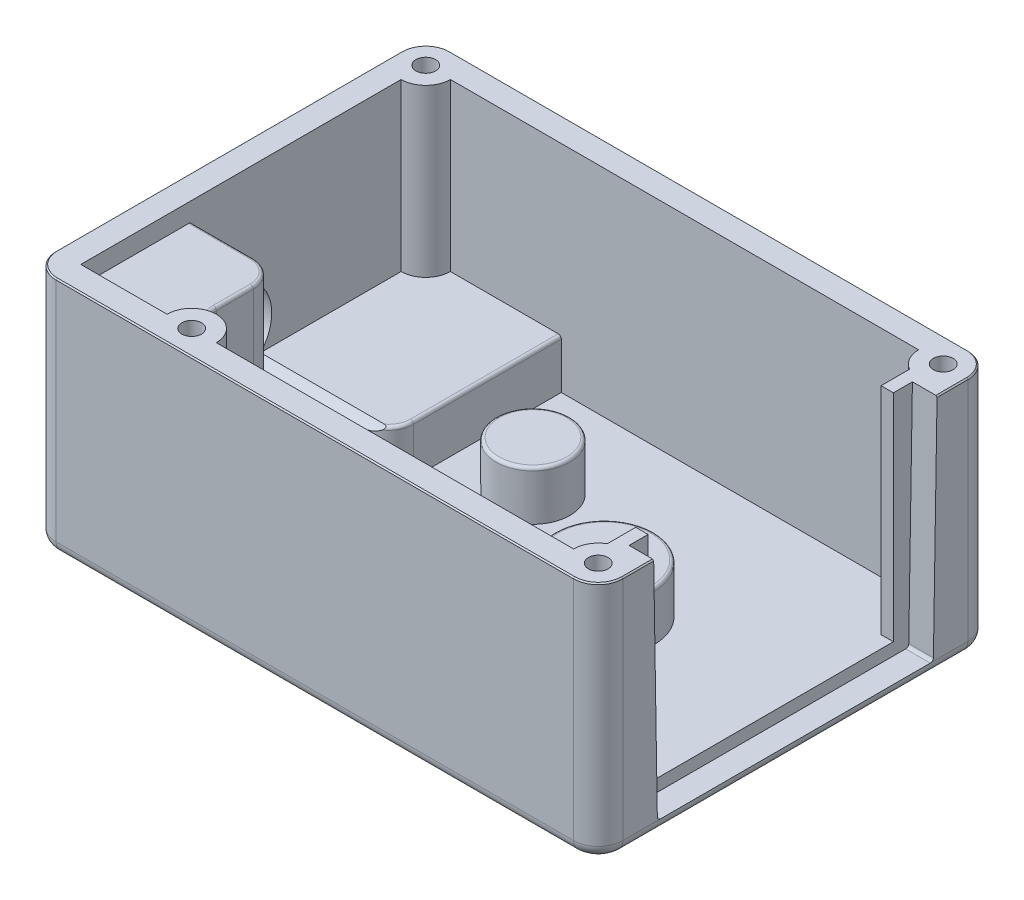
from build123d import *

# Parameters (mm, degrees)
BOSS_EXTRUDE1_DEPTH          = 19.5
FILLET1_R                    = 1
CUT_EXTRUDE1_START           = -17.5
CUT_EXTRUDE1_DEPTH           = 17.5
BOSS_EXTRUDE2_DEPTH          = 2
BOSS_EXTRUDE2_DEPTH_BACK     = 6
SKETCH6_R                    = 4
SKETCH6_R_2                  = 2.999999999999999
FILLET2_R                    = 0.25
M2X0_4_TAPPED_HOLE1_D        = 1.6
M2X0_4_TAPPED_HOLE1_DEPTH    = 8
M2X0_4_TAPPED_HOLE1_TIP      = 0.48068849522204826
CUT_EXTRUDE2_DEPTH           = 2
FILLET3_R                    = 0.25
BOSS_EXTRUDE3_START          = -17.5
BOSS_EXTRUDE3_DEPTH          = 17.5
M3X0_5_TAPPED_HOLE1_D        = 2.5
M3X0_5_TAPPED_HOLE1_DEPTH    = 7.5
M3X0_5_TAPPED_HOLE1_TIP      = 0.7510757737844503
F_7_0_7_DIAMETER_HOLE1_D     = 7
F_7_0_7_DIAMETER_HOLE1_DEPTH = 12.999
F_7_0_7_DIAMETER_HOLE1_TIP   = 2.103012166596461
BOSS_EXTRUDE4_DEPTH          = 16
BOSS_EXTRUDE5_DEPTH          = 4
FILLET4_R                    = 0.25
CHAMFER1_SIZE                = 0.1
SCALE1_SCALE                 = 1.5


with BuildPart() as part:
    # Sketch1 → Boss-Extrude1 (new body)
    with BuildSketch(Plane(origin=(0, 0, 0), x_dir=(1, 0, 0), z_dir=(0, 1, 0))):
        with BuildLine():
            Line((-28.499999999999993, 16), (13.500000000000002, 16))
            ThreePointArc((13.500000000000002, 16), (14.914213562373098, 15.414213562373096), (15.500000000000005, 14))
            Line((15.500000000000005, 14), (15.500000000000005, -14))
            ThreePointArc((15.500000000000005, -14), (14.914213562373098, -15.414213562373096), (13.500000000000002, -16))
            Line((13.500000000000002, -16), (-28.499999999999993, -16))
            ThreePointArc((-28.499999999999993, -16), (-29.914213562373092, -15.414213562373098), (-30.499999999999996, -14))
            Line((-30.499999999999996, -14), (-30.499999999999996, 14))
            ThreePointArc((-30.499999999999996, 14), (-29.91421356237309, 15.414213562373096), (-28.499999999999993, 16))
        make_face()
    extrude(amount=BOSS_EXTRUDE1_DEPTH)

    # Fillet1
    fillet1_edges = [part.edges().sort_by_distance(p)[0] for p in [
        (-30.499999999999996, 0, 0),
        (-29.91421356237309, 0, -15.414213562373096),
        (-7.4999999999999964, 0, -16),
        (14.914213562373098, 0, -15.414213562373096),
        (15.500000000000005, 0, 0),
        (14.914213562373098, 0, 15.414213562373096),
        (-7.499999999999995, 0, 16),
        (-29.914213562373092, 0, 15.414213562373098),
    ]]
    fillet(fillet1_edges, radius=FILLET1_R)

    # Sketch5 → Cut-Extrude1 (cut)
    with BuildSketch(Plane(origin=(0, 19.5, 0), x_dir=(1, 0, 0), z_dir=(0, 1, 0)).offset(CUT_EXTRUDE1_START)):
        with BuildLine():
            Line((-28.499999999999996, 12), (-28.499999999999996, -14))
            Line((-28.499999999999996, -14), (-21.499999999999957, -14))
            ThreePointArc((-21.499999999999957, -14), (-19.49999999999996, -12.00000000000001), (-17.499999999999968, -14))
            Line((-17.499999999999968, -14), (11.5, -14))
            ThreePointArc((11.5, -14), (12.085786437626906, -12.585786437626904), (13.500000000000002, -11.999999999999998))
            Line((13.500000000000002, -11.999999999999998), (13.500000000000004, 12))
            ThreePointArc((13.500000000000004, 12), (12.085786437626908, 12.585786437626904), (11.500000000000004, 14))
            Line((11.500000000000004, 14), (-26.499999999999993, 14))
            ThreePointArc((-26.499999999999993, 14), (-27.0857864376269, 12.585786437626904), (-28.499999999999996, 12))
        make_face()
    extrude(amount=CUT_EXTRUDE1_DEPTH, mode=Mode.SUBTRACT)

    # Sketch6 → Boss-Extrude2 (add, two sides: drawn at the far end of the back side and taken through both)
    with BuildSketch(Plane.XZ.offset(-BOSS_EXTRUDE2_DEPTH_BACK)):
        with Locations(Location((0, 0, 0), (0, 0, 270))):
            Circle(SKETCH6_R)
        with Locations(Location((-11.499999999999996, 5.7, 0), (0, 0, 270))):
            Circle(SKETCH6_R_2)
        with Locations(Location((-11.5, -5.7, 0), (0, 0, 270))):
            Circle(SKETCH6_R_2)
        with BuildLine():
            Line((-28.49999999999998, -12), (-19.50000000000001, -12))
            ThreePointArc((-19.50000000000001, -12), (-18.0857864376269, -11.414213562373096), (-17.499999999999996, -9.999999999999986))
            Line((-17.499999999999996, -9.999999999999986), (-17.499999999999996, -2.000000000000014))
            ThreePointArc((-17.499999999999996, -2.000000000000014), (-18.0857864376269, -0.5857864376269037), (-19.50000000000001, 0))
            Line((-19.50000000000001, 0), (-28.49999999999998, 0))
            ThreePointArc((-28.49999999999998, 0), (-29.914213562373092, -0.5857864376269035), (-30.499999999999996, -2.000000000000014))
            Line((-30.499999999999996, -2.000000000000014), (-30.499999999999996, -9.999999999999986))
            ThreePointArc((-30.499999999999996, -9.999999999999986), (-29.91421356237309, -11.414213562373096), (-28.49999999999998, -12))
        make_face()
    extrude(amount=BOSS_EXTRUDE2_DEPTH + BOSS_EXTRUDE2_DEPTH_BACK)

    # Fillet2
    fillet2_edges = [part.edges().sort_by_distance(p)[0] for p in [
        (-23.999999999999993, 0, 0),
        (-18.0857864376269, 0, -0.5857864376269037),
        (-17.499999999999996, 0, -6),
        (-18.0857864376269, 0, -11.414213562373096),
        (-23.999999999999993, 0, -12),
        (-29.01763809020504, 0, -0.06814834742186315),
        (-30.262854321468087, 0.3534296016750873, -1.0553600799974172),
        (-30.26285431890129, 0.3534296033295229, -10.944639918505356),
        (-29.01763809020504, 0, -11.931851652578136),
        (-29.914213562373092, -2, -0.5857864376269026),
        (-30.499999999999996, -2, -6),
        (-29.91421356237309, -2, -11.414213562373096),
        (-23.999999999999993, -2, -12),
        (-18.0857864376269, -2, -11.414213562373096),
        (-17.499999999999996, -2, -6),
        (-18.0857864376269, -2, -0.585786437626904),
        (-23.999999999999993, -2, 0),
        (1.22e-15, 0, 4),
        (1.22e-15, -2, 4),
        (-11.499999999999995, 0, 8.7),
        (-11.499999999999995, -2, 8.7),
        (-11.499999999999998, 0, -2.700000000000001),
        (-11.499999999999998, -2, -2.700000000000001),
    ]]
    fillet(fillet2_edges, radius=FILLET2_R)

    # M2x0.4 Tapped Hole1
    with Locations(Plane(origin=(0, 19.5, 0), x_dir=(1, 0, 0), z_dir=(0, 1, 0))):
        with Locations((-28.5, 14), (-19.5, -14), (13.5, -14), (13.5, 14)):
            Hole(M2X0_4_TAPPED_HOLE1_D / 2, depth=M2X0_4_TAPPED_HOLE1_DEPTH)
            with Locations((0, 0, -(M2X0_4_TAPPED_HOLE1_DEPTH + M2X0_4_TAPPED_HOLE1_TIP / 2))):  # 118° drill point
                Cone(0, M2X0_4_TAPPED_HOLE1_D / 2, M2X0_4_TAPPED_HOLE1_TIP, mode=Mode.SUBTRACT)

    # Sketch9 → Cut-Extrude2 (cut)
    with BuildSketch(Plane(origin=(15.500000000000005, 0, 0), x_dir=(0, 0, -1), z_dir=(1, 0, 0))):
        Polygon((-11.5, 19.5), (11.5, 19.5), (11.2, 1.000000000000001), (-11.2, 0.9999999999999986), align=None)
    extrude(amount=-CUT_EXTRUDE2_DEPTH, mode=Mode.SUBTRACT)

    # Fillet3
    fillet3_edges = [part.edges().sort_by_distance(p)[0] for p in [
        (14.500000000000005, 0.9999999999999986, 11.2),
        (14.500000000000005, 1.000000000000001, -11.2),
    ]]
    fillet(fillet3_edges, radius=FILLET3_R)

    # Sketch10 → Boss-Extrude3 (add)
    with BuildSketch(Plane(origin=(0, 19.5, 0), x_dir=(1, 0, 0), z_dir=(0, 1, 0)).offset(BOSS_EXTRUDE3_START)):
        with BuildLine():
            Line((13.500000000000002, 9.95402118550619), (12.5, 9.95402118550619))
            Line((12.5, 9.95402118550619), (12.5, 12.267949192431125))
            ThreePointArc((12.5, 12.267949192431125), (12.98236190979496, 12.068148347421864), (13.500000000000004, 12))
            Line((13.500000000000004, 12), (13.500000000000002, 9.95402118550619))
        make_face()
        with BuildLine():
            Line((12.5, -9.95402118550619), (12.5, -12.267949192431125))
            ThreePointArc((12.5, -12.267949192431125), (12.98236190979496, -12.068148347421864), (13.500000000000004, -12))
            Line((13.500000000000004, -12), (13.500000000000002, -9.95402118550619))
            Line((13.500000000000002, -9.95402118550619), (12.5, -9.95402118550619))
        make_face()
    extrude(amount=BOSS_EXTRUDE3_DEPTH)

    # M3x0.5 Tapped Hole1
    with Locations(Plane.ZY.offset(30.499999999999996)):
        with Locations((-4.01040764, 2.33959236), (8.01040764, 14.36040764)):
            Hole(M3X0_5_TAPPED_HOLE1_D / 2, depth=M3X0_5_TAPPED_HOLE1_DEPTH)
            with Locations((0, 0, -(M3X0_5_TAPPED_HOLE1_DEPTH + M3X0_5_TAPPED_HOLE1_TIP / 2))):  # 118° drill point
                Cone(0, M3X0_5_TAPPED_HOLE1_D / 2, M3X0_5_TAPPED_HOLE1_TIP, mode=Mode.SUBTRACT)

    # Ø7.0 (7) Diameter Hole1
    with Locations(Plane.ZY.offset(30.499999999999996)):
        with Locations((2, 8.35)):
            Hole(F_7_0_7_DIAMETER_HOLE1_D / 2, depth=F_7_0_7_DIAMETER_HOLE1_DEPTH)
            with Locations((0, 0, -(F_7_0_7_DIAMETER_HOLE1_DEPTH + F_7_0_7_DIAMETER_HOLE1_TIP / 2))):  # 118° drill point
                Cone(0, F_7_0_7_DIAMETER_HOLE1_D / 2, F_7_0_7_DIAMETER_HOLE1_TIP, mode=Mode.SUBTRACT)

    # Sketch18 → Boss-Extrude4 (add)
    with BuildSketch(Plane(origin=(0, 1.9999999999999982, 0), x_dir=(1, 0, 0), z_dir=(0, 1, 0))):
        with BuildLine():
            Line((-28.499999999999993, -5.000000000000003), (-23.499999999999996, -5.000000000000008))
            ThreePointArc((-23.499999999999996, -5.000000000000008), (-22.0857864376269, -5.585786437626913), (-21.5, -7.000000000000008))
            Line((-21.5, -7.000000000000008), (-21.5, -10.000000000000009))
            ThreePointArc((-21.5, -10.000000000000009), (-20.91421356237308, -11.414213562373119), (-19.49999999999996, -12.000000000000009))
            ThreePointArc((-19.49999999999996, -12.000000000000009), (-20.91421356237305, -12.585786437626911), (-21.499999999999957, -14))
            Line((-21.499999999999957, -14), (-28.499999999999996, -14))
            Line((-28.499999999999996, -14), (-28.499999999999993, -5.000000000000003))
        make_face()
    extrude(amount=BOSS_EXTRUDE4_DEPTH)

    # Sketch19 → Boss-Extrude5 (add)
    with BuildSketch(Plane(origin=(0, 1.9999999999999982, 0), x_dir=(1, 0, 0), z_dir=(0, 1, 0))):
        with BuildLine():
            Line((-17.499999999999996, 14), (-26.499999999999993, 14))
            ThreePointArc((-26.499999999999993, 14), (-27.0857864376269, 12.585786437626904), (-28.499999999999996, 12))
            Line((-28.499999999999996, 12), (-19.50000000000001, 11.999999999999998))
            ThreePointArc((-19.50000000000001, 11.999999999999998), (-18.0857864376269, 11.414213562373094), (-17.499999999999996, 9.999999999999986))
            Line((-17.499999999999996, 9.999999999999986), (-17.499999999999996, 14))
        make_face()
    extrude(amount=BOSS_EXTRUDE5_DEPTH)

    # Fillet4
    # the kernel refuses this fillet: 0.25 mm, written as the material it takes off along each edge
    with BuildSketch(Plane(origin=(-19.499999999999993, 6, -1.9999999999999964), x_dir=(1, 0, -8.88e-15), z_dir=(-8.88e-15, 0, -1))) as fillet4_piece_1:
        with BuildLine():
            CenterArc((1.9999999999999964 - FILLET4_R, FILLET4_R), FILLET4_R, 270, 89.99999999999959)
            Line((1.9999999999999964, FILLET4_R), (1.9999999999999964, 0))
            Line((1.9999999999999964, 0), (1.9999999999999964 - FILLET4_R, 1.78e-15))
        make_face()
    revolve(axis=Axis((-19.499999999999993, 6, -1.9999999999999964), (0, -1, 0)), revolution_arc=62.58527065079586, mode=Mode.SUBTRACT)
    with BuildSketch(Plane(origin=(-17.499999999999996, 5.999999999999998, -14), x_dir=(-1, 0, 0), z_dir=(0, 1.5e-16, 1))) as fillet4_piece_2:
        with BuildLine():
            CenterArc((FILLET4_R, FILLET4_R), FILLET4_R, 180, 90)
            Line((0, FILLET4_R), (0, 0))
            Line((0, 0), (FILLET4_R, 0))
        make_face()
    extrude(amount=11.999999999999986, mode=Mode.SUBTRACT)
    with BuildSketch(Plane(origin=(-19.500000000000004, 18, 10.000000000000012), x_dir=(-1, 0, -1.78e-15), z_dir=(1.78e-15, 0, -1))) as fillet4_piece_3_section:
        with BuildLine():
            CenterArc((1.9999999999999964 + FILLET4_R, -FILLET4_R), FILLET4_R, 90, 90)
            Line((1.9999999999999964, -FILLET4_R), (1.9999999999999964, 0))
            Line((1.9999999999999964, 0), (1.9999999999999964 + FILLET4_R, 0))
        make_face()
    fillet4_piece_3 = revolve(axis=Axis((-19.500000000000004, 18, 10.000000000000012), (0, 1, 0)), revolution_arc=107.91212365467567, mode=Mode.PRIVATE)
    fillet4_piece_3 = fillet4_piece_3 - Plane(origin=(-19.49999999999996, 17.958494207219477, 14.000000000000005), x_dir=(-1, 0, -2.66e-15), z_dir=(0, -1, 0)) * Cylinder(1.9999999999999947, 9, mode=Mode.PRIVATE)
    add(fillet4_piece_3, mode=Mode.SUBTRACT)
    with BuildSketch(Plane(origin=(-21.5, 18, 7.000000000000008), x_dir=(-1, 0, 0), z_dir=(0, 0, 1))) as fillet4_piece_4:
        with BuildLine():
            CenterArc((FILLET4_R, FILLET4_R), FILLET4_R, 180, 90)
            Line((0, FILLET4_R), (0, 0))
            Line((0, 0), (FILLET4_R, 0))
        make_face()
    extrude(amount=3.000000000000001, mode=Mode.SUBTRACT)
    with BuildSketch(Plane(origin=(-23.499999999999993, 18, 7.000000000000001), x_dir=(-1.78e-15, 0, -1), z_dir=(-1, 0, 1.78e-15))) as fillet4_piece_5:
        with BuildLine():
            CenterArc((1.999999999999993 - FILLET4_R, FILLET4_R), FILLET4_R, 270, 90)
            Line((1.999999999999993, FILLET4_R), (1.999999999999993, 0))
            Line((1.999999999999993, 0), (1.999999999999993 - FILLET4_R, 0))
        make_face()
    revolve(axis=Axis((-23.499999999999993, 18, 7.000000000000001), (0, -1, 0)), revolution_arc=90.0000000000003, mode=Mode.SUBTRACT)
    with BuildSketch(Plane(origin=(-28.499999999999993, 18, 5.000000000000003), x_dir=(0, -1, 0), z_dir=(1, 0, 1.07e-15))) as fillet4_piece_6:
        with BuildLine():
            CenterArc((FILLET4_R, -FILLET4_R), FILLET4_R, 90, 90)
            Line((0, -FILLET4_R), (0, 0))
            Line((0, 0), (FILLET4_R, 0))
        make_face()
    extrude(amount=4.9999999999999964, mode=Mode.SUBTRACT)
    with BuildSketch(Plane(origin=(0, 6, 0), x_dir=(-1.8e-16, 0, -1), z_dir=(-1, 0, 1.8e-16))) as fillet4_piece_7:
        with BuildLine():
            CenterArc((4 - FILLET4_R, FILLET4_R), FILLET4_R, 270, 90)
            Line((4 - FILLET4_R, 0), (4, 0))
            Line((4, 0), (4, FILLET4_R))
        make_face()
    revolve(axis=Axis((0, 6, 0), (0, -1, 0)), mode=Mode.SUBTRACT)
    with BuildSketch(Plane(origin=(-11.499999999999996, 6, 5.7), x_dir=(0, 0, -1), z_dir=(-1, 0, 0))) as fillet4_piece_8:
        with BuildLine():
            CenterArc((2.999999999999999 - FILLET4_R, FILLET4_R), FILLET4_R, 270, 90)
            Line((2.999999999999999 - FILLET4_R, 0), (2.999999999999999, 0))
            Line((2.999999999999999, 0), (2.999999999999999, FILLET4_R))
        make_face()
    revolve(axis=Axis((-11.499999999999996, 6, 5.7), (0, -1, 0)), mode=Mode.SUBTRACT)
    with BuildSketch(Plane(origin=(-11.5, 6, -5.7), x_dir=(0, 0, -1), z_dir=(-1, 0, 0))) as fillet4_piece_9:
        with BuildLine():
            CenterArc((2.999999999999999 - FILLET4_R, FILLET4_R), FILLET4_R, 270, 90)
            Line((2.999999999999999 - FILLET4_R, 0), (2.999999999999999, 0))
            Line((2.999999999999999, 0), (2.999999999999999, FILLET4_R))
        make_face()
    revolve(axis=Axis((-11.5, 6, -5.7), (0, -1, 0)), mode=Mode.SUBTRACT)

    # Chamfer1
    chamfer1_edges = [part.edges().sort_by_distance(p)[0] for p in [
        (-29.91421356237309, 19.5, -15.414213562373096),
        (-30.499999999999996, 19.5, 0),
        (-29.914213562373092, 19.5, 15.414213562373098),
        (15.500000000000005, 19.5, -12.75),
        (-7.499999999999995, 19.5, 16),
        (14.914213562373098, 19.5, 15.414213562373096),
        (15.500000000000005, 19.5, 12.75),
        (14.914213562373098, 19.5, -15.414213562373096),
        (-7.4999999999999964, 19.5, -16),
    ]]
    chamfer(chamfer1_edges, length=CHAMFER1_SIZE)


with BuildPart() as part_1:
    # Scale1: scaled about (-12.129927426, 6.556768953, 0.452729088)
    add(part.part.scale(SCALE1_SCALE).moved(Location((6.064963713, -3.2783844765, -0.226364544))))


solid = part_1.part
